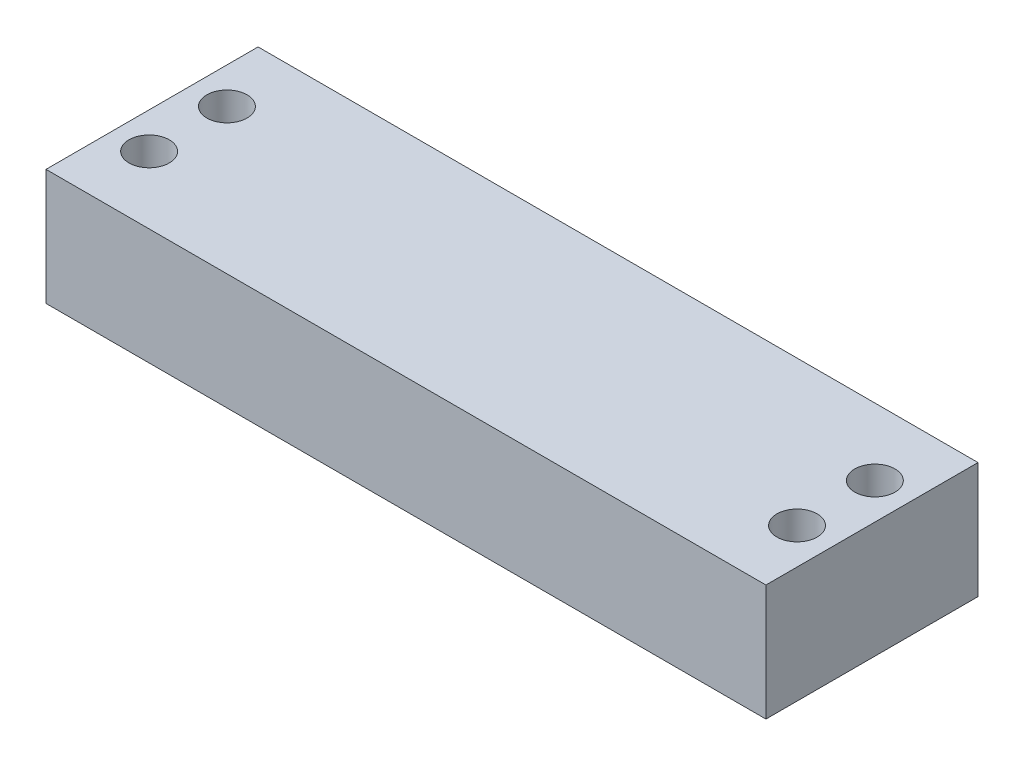
from build123d import *

# Parameters (mm, degrees)
SKETCH1_W           = 74
SKETCH1_H           = 21.8
SKETCH1_R           = 2.0701
BOSS_EXTRUDE1_DEPTH = 11.938


with BuildPart() as part:
    # Sketch1 → Boss-Extrude1 (new body)
    with BuildSketch(Plane(origin=(0, 0, 0), x_dir=(1, 0, 0), z_dir=(0, 1, 0))):
        with Locations((37, 10.9)):
            Rectangle(SKETCH1_W, SKETCH1_H)
        with Locations((3.7, 6.9)):
            Circle(SKETCH1_R, mode=Mode.SUBTRACT)
        with Locations((3.7, 14.9)):
            Circle(SKETCH1_R, mode=Mode.SUBTRACT)
        with Locations((70.3, 6.9)):
            Circle(SKETCH1_R, mode=Mode.SUBTRACT)
        with Locations((70.3, 14.9)):
            Circle(SKETCH1_R, mode=Mode.SUBTRACT)
    extrude(amount=BOSS_EXTRUDE1_DEPTH)


solid = part.part
